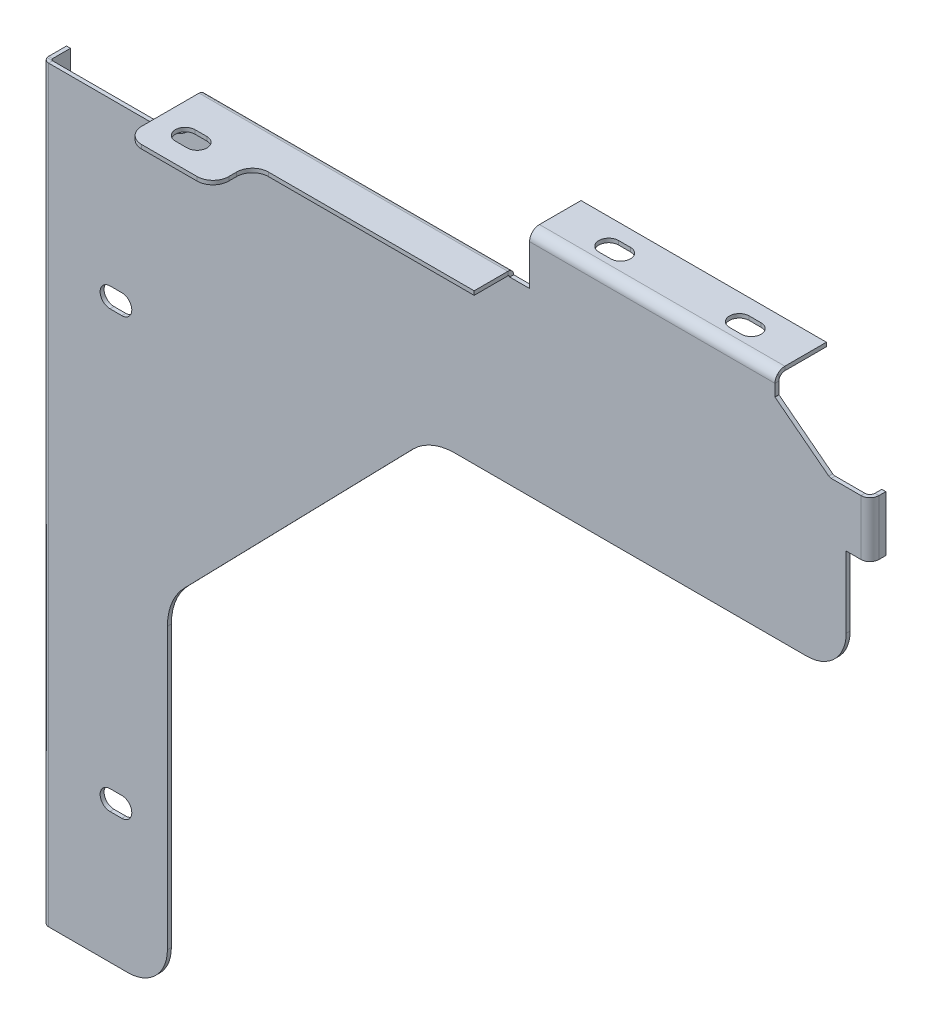
from build123d import *

# Parameters (mm, degrees)
BASE_FLANGE1_DEPTH            = 1
EDGE_FLANGE1_STRIP_W          = 5
EDGE_FLANGE1_STRIP_H          = 1
EDGE_FLANGE1_STRIP_CUT_DEPTH  = 189
EDGE_FLANGE1_RELIEF_W         = 5.5
EDGE_FLANGE1_RELIEF_H         = 0.5
EDGE_FLANGE1_RELIEF_CUT_DEPTH = 1
EDGE_FLANGE1_DEPTH            = 189
CUT_EXTRUDE1_DEPTH            = 10
EDGE_FLANGE2_STRIP_W          = 7
EDGE_FLANGE2_STRIP_H          = 1
EDGE_FLANGE2_STRIP_CUT_DEPTH  = 62
EDGE_FLANGE2_RELIEF_W         = 7.5
EDGE_FLANGE2_RELIEF_H         = 0.5
EDGE_FLANGE2_RELIEF_CUT_DEPTH = 1
EDGE_FLANGE2_DEPTH            = 62
SKETCH13_W                    = 5
SKETCH13_H                    = 14
TAB1_DEPTH                    = 1
CUT_EXTRUDE4_DEPTH            = 10
EDGE_FLANGE3_STRIP_W          = 6.54
EDGE_FLANGE3_STRIP_H          = 1
EDGE_FLANGE3_STRIP_CUT_DEPTH  = 14
EDGE_FLANGE3_DEPTH            = 14
CUT_EXTRUDE3_DEPTH            = 10
EDGE_FLANGE5_DEPTH            = 78
SKETCH33_W                    = 22
SKETCH33_H                    = 10
TAB2_DEPTH                    = 1
FILLET1_R                     = 4
FILLET2_R                     = 4
CUT_EXTRUDE5_DEPTH            = 1
CUT_EXTRUDE6_DEPTH            = 1
CUT_EXTRUDE7_DEPTH            = 1


# Sheet-metal steps are written as plain solids
with BuildPart() as part:
    # Sketch1 → Base-Flange1 (new body)
    with BuildSketch(Plane.XY):
        with BuildLine():
            Line((0, 0), (0, -212.19))
            Line((0, -212.19), (20.5, -212.19))
            ThreePointArc((20.5, -212.19), (27.571067812, -209.261067812), (30.5, -202.19))
            Line((30.5, -202.19), (30.5, -131.403203436))
            ThreePointArc((30.5, -131.403203436), (31.641807012, -125.66295195), (34.893398282, -120.796601718))
            Line((34.893398282, -120.796601718), (92.574639149, -61.583398282))
            ThreePointArc((92.574639149, -61.583398282), (97.440989382, -58.331807012), (103.181240867, -57.19))
            Line((103.181240867, -57.19), (192, -57.19))
            ThreePointArc((192, -57.19), (199.071067812, -54.261067812), (202, -47.19))
            Line((202, -47.19), (202, 0))
            Line((202, 0), (0, 0))
        make_face()
    extrude(amount=-BASE_FLANGE1_DEPTH)

    # Edge-Flange1 strip (across the edge) → Edge-Flange1 strip cut (cut)
    with BuildSketch(Plane.XZ.offset(23.19)):
        with Locations((-2, -0.5)):
            Rectangle(EDGE_FLANGE1_STRIP_W, EDGE_FLANGE1_STRIP_H)
    extrude(amount=EDGE_FLANGE1_STRIP_CUT_DEPTH, mode=Mode.SUBTRACT)

    # Edge-Flange1 relief (on the sheet) → Edge-Flange1 relief cut (cut)
    with BuildSketch(Plane(origin=(0.5, -23.19, 0), x_dir=(1, 0, 0), z_dir=(0, 0, 1))):
        with Locations((-2.25, 0.25)):
            Rectangle(EDGE_FLANGE1_RELIEF_W, EDGE_FLANGE1_RELIEF_H)
    extrude(amount=-EDGE_FLANGE1_RELIEF_CUT_DEPTH, mode=Mode.SUBTRACT)

    # Edge-Flange1 section (across the edge) → Edge-Flange1 (add)
    with BuildSketch(Plane.XZ.offset(23.19)):
        with BuildLine():
            Line((-1, 0.5), (-1, 5))
            Line((-1, 5), (0, 5))
            Line((0, 5), (0, 0.5))
            ThreePointArc((0, 0.5), (0.146446609, 0.146446609), (0.5, 0))
            Line((0.5, 0), (0.5, -1))
            ThreePointArc((0.5, -1), (-0.560660172, -0.560660172), (-1, 0.5))
        make_face()
    extrude(amount=EDGE_FLANGE1_DEPTH)

    # Sketch9 → Cut-Extrude1 (cut)
    with BuildSketch(Plane.XY):
        with BuildLine():
            Line((-1, -23.19), (29, -23.19))
            ThreePointArc((29, -23.19), (36.071067812, -20.261067812), (39, -13.19))
            Line((39, -13.19), (39, 0))
            Line((39, 0), (-1, 0))
            Line((-1, 0), (-1, -23.19))
        make_face()
    extrude(amount=-CUT_EXTRUDE1_DEPTH, mode=Mode.SUBTRACT)

    # Edge-Flange2 strip (across the edge) → Edge-Flange2 strip cut (cut)
    with BuildSketch(Plane(origin=(184, 0, 0), x_dir=(0, -1, 0), z_dir=(-1, 0, 0))):
        with Locations((-2, -0.5)):
            Rectangle(EDGE_FLANGE2_STRIP_W, EDGE_FLANGE2_STRIP_H)
    extrude(amount=EDGE_FLANGE2_STRIP_CUT_DEPTH, mode=Mode.SUBTRACT)

    # Edge-Flange2 relief (on the sheet) → Edge-Flange2 relief cut (cut)
    with BuildSketch(Plane(origin=(184, -1.5, 0), x_dir=(0, -1, 0), z_dir=(0, 0, 1))):
        with Locations((-3.25, 0.25)):
            Rectangle(EDGE_FLANGE2_RELIEF_W, EDGE_FLANGE2_RELIEF_H)
        with Locations((-3.25, -62.25)):
            Rectangle(EDGE_FLANGE2_RELIEF_W, EDGE_FLANGE2_RELIEF_H)
    extrude(amount=-EDGE_FLANGE2_RELIEF_CUT_DEPTH, mode=Mode.SUBTRACT)

    # Edge-Flange2 section (across the edge) → Edge-Flange2 (add)
    with BuildSketch(Plane(origin=(184, 0, 0), x_dir=(0, -1, 0), z_dir=(-1, 0, 0))):
        with BuildLine():
            Line((-1, 1.5), (-1, 12))
            Line((-1, 12), (0, 12))
            Line((0, 12), (0, 1.5))
            ThreePointArc((0, 1.5), (0.439339828, 0.439339828), (1.5, 0))
            Line((1.5, 0), (1.5, -1))
            ThreePointArc((1.5, -1), (-0.267766953, -0.267766953), (-1, 1.5))
        make_face()
    extrude(amount=EDGE_FLANGE2_DEPTH)

    # Sketch13 → Tab1 (add)
    with BuildSketch(Plane.XY):
        with Locations((204.5, -22.19)):
            Rectangle(SKETCH13_W, SKETCH13_H)
    extrude(amount=-TAB1_DEPTH)

    # Sketch16 → Cut-Extrude4 (cut)
    with BuildSketch(Plane.XY):
        with BuildLine():
            Line((202, -15.19), (198.18765136, -15.19))
            ThreePointArc((198.18765136, -15.19), (197.864812853, -15.136454066), (197.576547726, -14.981550598))
            Line((197.576547726, -14.981550598), (184.019444818, -4.515012052))
            ThreePointArc((184.019444818, -4.515012052), (184.005123731, -4.497482662), (184, -4.475434523))
            Line((184, -4.475434523), (184, -1.5))
            Line((184, -1.5), (184, 0))
            Line((184, 0), (202, 0))
            Line((202, 0), (202, -15.19))
        make_face()
    extrude(amount=-CUT_EXTRUDE4_DEPTH, mode=Mode.SUBTRACT)

    # Edge-Flange3 strip (across the edge) → Edge-Flange3 strip cut (cut)
    with BuildSketch(Plane(origin=(207, -29.19, 0), x_dir=(-1, 0, 0), z_dir=(0, 1, 0))):
        with Locations((-2, -0.5)):
            Rectangle(EDGE_FLANGE3_STRIP_W, EDGE_FLANGE3_STRIP_H)
    extrude(amount=EDGE_FLANGE3_STRIP_CUT_DEPTH, mode=Mode.SUBTRACT)

    # Edge-Flange3 section (across the edge) → Edge-Flange3 (add)
    with BuildSketch(Plane(origin=(207, -29.19, 0), x_dir=(-1, 0, 0), z_dir=(0, 1, 0))):
        with BuildLine():
            Line((-1, 1.27), (-1, 3))
            Line((-1, 3), (0, 3))
            Line((0, 3), (0, 1.27))
            ThreePointArc((0, 1.27), (0.371974388, 0.371974388), (1.27, 0))
            Line((1.27, 0), (1.27, -1))
            ThreePointArc((1.27, -1), (-0.335132393, -0.335132393), (-1, 1.27))
        make_face()
    extrude(amount=EDGE_FLANGE3_DEPTH)

    # Sketch20 → Cut-Extrude3 (cut)
    with BuildSketch(Plane.XY):
        Polygon((122, -0.75), (122, -11.75), (38.53901494, -11.75), (38.53901494, 0), (122, 0), align=None)
    extrude(amount=-CUT_EXTRUDE3_DEPTH, mode=Mode.SUBTRACT)

    # Edge-Flange5 section (across the edge) → Edge-Flange5 (add)
    with BuildSketch(Plane(origin=(39, -11.25, -1), x_dir=(0, -1, 0), z_dir=(1, 0, 0))):
        with BuildLine():
            Line((-1, 0.5), (-1, 9))
            Line((-1, 9), (0, 9))
            Line((0, 9), (0, 0.5))
            ThreePointArc((0, 0.5), (0.146446609, 0.146446609), (0.5, 0))
            Line((0.5, 0), (0.5, -1))
            ThreePointArc((0.5, -1), (-0.560660172, -0.560660172), (-1, 0.5))
        make_face()
    extrude(amount=EDGE_FLANGE5_DEPTH)

    # Sketch33 → Tab2 (add)
    with BuildSketch(Plane(origin=(0, -10.25, 0), x_dir=(1, 0, 0), z_dir=(0, 1, 0))):
        with Locations((50, 15)):
            Rectangle(SKETCH33_W, SKETCH33_H)
    extrude(amount=-TAB2_DEPTH)

    # Fillet1
    fillet1_edges = [part.edges().sort_by_distance(p)[0] for p in [
        (61, -10.75, -10),
    ]]
    fillet(fillet1_edges, radius=FILLET1_R)

    # Fillet2
    fillet2_edges = [part.edges().sort_by_distance(p)[0] for p in [
        (39, -10.75, -20),
        (61, -10.75, -20),
    ]]
    fillet(fillet2_edges, radius=FILLET2_R)

    # Sketch35 → Cut-Extrude5 (cut)
    with BuildSketch(Plane(origin=(0, 1, 0), x_dir=(1, 0, 0), z_dir=(0, 1, 0))):
        with BuildLine():
            Line((171.5, -8), (168.5, -8))
            ThreePointArc((168.5, -8), (166, -5.5), (168.5, -3))
            Line((168.5, -3), (171.5, -3))
            ThreePointArc((171.5, -3), (174, -5.5), (171.5, -8))
        make_face()
        with BuildLine():
            Line((138.5, -8), (135.5, -8))
            ThreePointArc((135.5, -8), (133, -5.5), (135.5, -3))
            Line((135.5, -3), (138.5, -3))
            ThreePointArc((138.5, -3), (141, -5.5), (138.5, -8))
        make_face()
    extrude(amount=-CUT_EXTRUDE5_DEPTH, mode=Mode.SUBTRACT)

    # Sketch36 → Cut-Extrude6 (cut)
    with BuildSketch(Plane.XZ.offset(11.25)):
        with BuildLine():
            Line((49.5, -15), (46.5, -15))
            ThreePointArc((46.5, -15), (44, -12.5), (46.5, -10))
            Line((46.5, -10), (49.5, -10))
            ThreePointArc((49.5, -10), (52, -12.5), (49.5, -15))
        make_face()
    extrude(amount=-CUT_EXTRUDE6_DEPTH, mode=Mode.SUBTRACT)

    # Sketch38 → Cut-Extrude7 (cut)
    with BuildSketch(Plane.XY):
        with BuildLine():
            Line((16, -174.19), (19, -174.19))
            ThreePointArc((19, -174.19), (21.5, -176.69), (19, -179.19))
            Line((19, -179.19), (16, -179.19))
            ThreePointArc((16, -179.19), (13.5, -176.69), (16, -174.19))
        make_face()
        with BuildLine():
            Line((16, -64.19), (19, -64.19))
            ThreePointArc((19, -64.19), (21.5, -66.69), (19, -69.19))
            Line((19, -69.19), (16, -69.19))
            ThreePointArc((16, -69.19), (13.5, -66.69), (16, -64.19))
        make_face()
    extrude(amount=-CUT_EXTRUDE7_DEPTH, mode=Mode.SUBTRACT)


with BuildPart() as body_2:
    # Mirror1: mirrored copy
    add(part.part.mirror(Plane.XY.offset(12)))


solid = body_2.part
